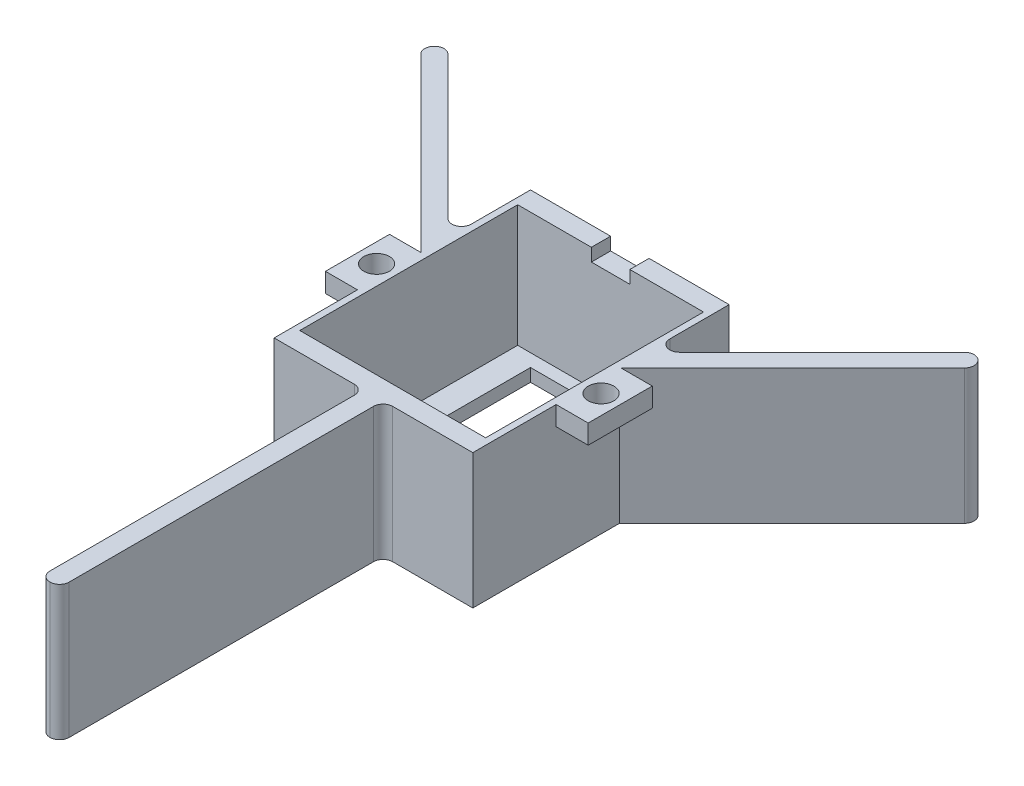
from build123d import *

# Parameters (mm, degrees)
SKETCH1_W           = 31
SKETCH1_H           = 40
SKETCH1_W_2         = 21
SKETCH1_H_2         = 30
BOSS_EXTRUDE1_DEPTH = 2
SKETCH2_W           = 31
SKETCH2_H           = 40
SKETCH2_W_2         = 29
SKETCH2_H_2         = 34
BOSS_EXTRUDE2_DEPTH = 19
SKETCH4_W           = 5
SKETCH4_H           = 10
SKETCH4_R           = 2
BOSS_EXTRUDE3_DEPTH = 3
BOSS_EXTRUDE4_START = -21
SKETCH5_W           = 3
SKETCH5_H           = 50.481247069
BOSS_EXTRUDE4_DEPTH = 21
FILLET2_R           = 1.5
SKETCH7_W           = 6
SKETCH7_H           = 3
CUT_EXTRUDE4_DEPTH  = 2


with BuildPart() as part:
    # Sketch1 → Boss-Extrude1 (new body)
    with BuildSketch(Plane(origin=(0, 0, 0), x_dir=(1, 0, 0), z_dir=(0, 1, 0))):
        Rectangle(SKETCH1_W, SKETCH1_H)
        Rectangle(SKETCH1_W_2, SKETCH1_H_2, mode=Mode.SUBTRACT)
    extrude(amount=BOSS_EXTRUDE1_DEPTH)

    # Sketch2 → Boss-Extrude2 (add)
    with BuildSketch(Plane(origin=(0, 2, 0), x_dir=(1, 0, 0), z_dir=(0, 1, 0))):
        Rectangle(SKETCH2_W, SKETCH2_H)
        Rectangle(SKETCH2_W_2, SKETCH2_H_2, mode=Mode.SUBTRACT)
    extrude(amount=BOSS_EXTRUDE2_DEPTH)

    # Sketch4 → Boss-Extrude3 (add)
    with BuildSketch(Plane(origin=(0, 21, 0), x_dir=(1, 0, 0), z_dir=(0, 1, 0))):
        with Locations((18, -2)):
            Rectangle(SKETCH4_W, SKETCH4_H)
        with Locations(Location((17.51, -2, 0), (0, 0, 270))):
            Circle(SKETCH4_R, mode=Mode.SUBTRACT)
    boss_extrude3 = extrude(amount=-BOSS_EXTRUDE3_DEPTH)

    # Mirror1: Boss-Extrude3 across plane
    add(boss_extrude3.mirror(Plane(origin=(0, 0, 0), x_dir=(0, 0, 1), z_dir=(1, 0, 0))))

    # Sketch5 → Boss-Extrude4 (add)
    with BuildSketch(Plane.XZ.offset(BOSS_EXTRUDE4_START)):
        with Locations((0, 45.240623535)):
            Rectangle(SKETCH5_W, SKETCH5_H)
        Polygon((-41.352486375, -32.973806719), (-43.473806719, -30.852486375), (-15.5, -2.878679656), (-15.5, -7.121320344), align=None)
        Polygon((15.5, -2.878679656), (43.473806719, -30.852486375), (41.352486375, -32.973806719), (15.5, -7.121320344), align=None)
    extrude(amount=BOSS_EXTRUDE4_DEPTH)

    # Fillet2
    fillet2_edges = [part.edges().sort_by_distance(p)[0] for p in [
        (-41.352486375, 10.5, -32.973806719),
        (-43.473806719, 10.5, -30.852486375),
        (41.352486375, 10.5, -32.973806719),
        (43.473806719, 10.5, -30.852486375),
        (1.5, 10.5, 70.481247069),
        (-1.5, 10.5, 70.481247069),
        (1.5, 10.5, 20),
        (-1.5, 10.5, 20),
        (-15.5, 10.5, -7.121320344),
        (15.5, 10.5, -7.121320344),
    ]]
    fillet(fillet2_edges, radius=FILLET2_R - 0.0001)  # a hair under: the kernel refuses the full size

    # Sketch7 → Cut-Extrude4 (cut)
    with BuildSketch(Plane(origin=(0, 21, 0), x_dir=(1, 0, 0), z_dir=(0, 1, 0))):
        with Locations((0, 18.5)):
            Rectangle(SKETCH7_W, SKETCH7_H)
    extrude(amount=-CUT_EXTRUDE4_DEPTH, mode=Mode.SUBTRACT)


solid = part.part
